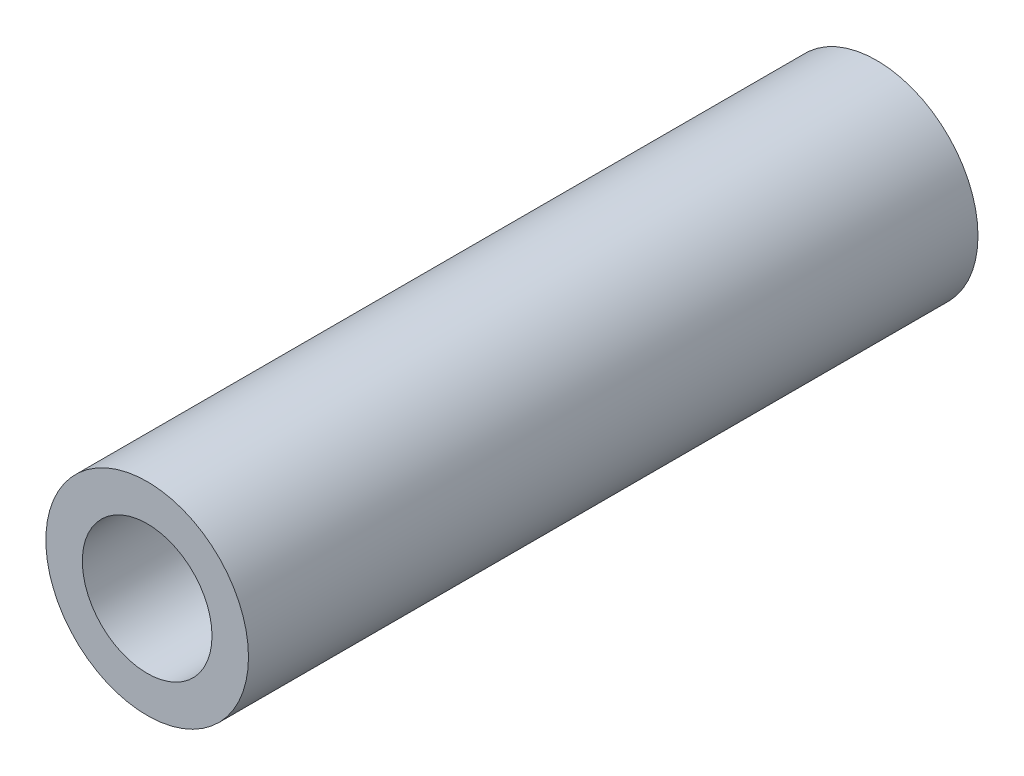
from build123d import *

# Parameters (mm, degrees)
SKETCH1_R           = 2.5
BOSS_EXTRUDE1_DEPTH = 18
CUT_EXTRUDE1_REACH  = 41.881
SKETCH3_R           = 1.6


with BuildPart() as part:
    # Sketch1 → Boss-Extrude1 (new body)
    with BuildSketch(Plane.XY):
        with Locations((33, 0)):
            Circle(SKETCH1_R)
    extrude(amount=BOSS_EXTRUDE1_DEPTH)

    # Sketch3 → Cut-Extrude1 (cut, up to next)
    with BuildSketch(Plane.XY.offset(18), mode=Mode.PRIVATE) as cut_extrude1_sk1:
        with Locations((33, 0)):
            Circle(SKETCH3_R)
    cut_extrude1_tool1 = extrude(cut_extrude1_sk1.sketch, amount=-CUT_EXTRUDE1_REACH, mode=Mode.PRIVATE) & part.part
    add(cut_extrude1_tool1.solids().sort_by_distance((33, 0, 18))[0], mode=Mode.SUBTRACT)


solid = part.part
